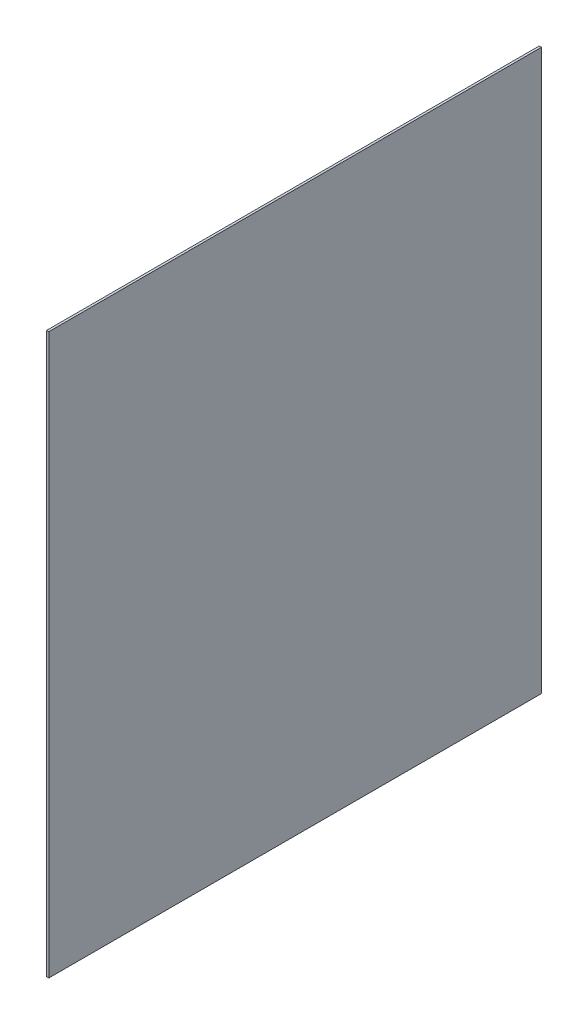
from build123d import *

# Parameters (mm, degrees)
SKETCH_1_W             = 2
SKETCH_1_H             = 500
SM_BASE_FLANGE_1_DEPTH = 440


# Sheet-metal steps are written as plain solids
with BuildPart() as part:
    # Sketch 1 → Базовая кромка1 (new body)
    with BuildSketch(Plane.XY):
        with Locations((1, 250)):
            Rectangle(SKETCH_1_W, SKETCH_1_H)
    extrude(amount=SM_BASE_FLANGE_1_DEPTH)


solid = part.part
